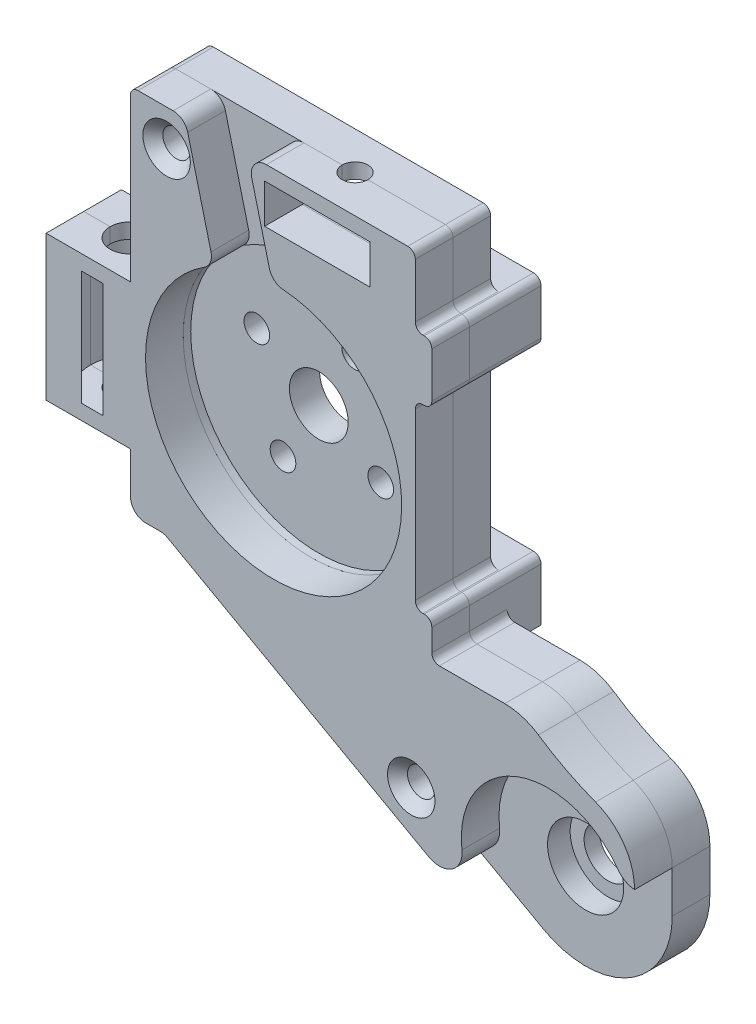
from build123d import *

# Parameters (mm, degrees)
SKETCH1_W                                      = 5.2
SKETCH1_H                                      = 14
SKETCH1_R                                      = 3.2
SKETCH1_R_2                                    = 1.7
SKETCH1_R_3                                    = 3.9
BOSS_EXTRUDE1_DEPTH                            = 10
SKETCH2_R                                      = 2.6
CUT_EXTRUDE1_DEPTH                             = 20
SKETCH3_R                                      = 5.1
CUT_EXTRUDE2_DEPTH                             = 15.2
BOSS_EXTRUDE2_DEPTH                            = 0.45
BOSS_EXTRUDE2_DEPTH_BACK                       = 0.45
SKETCH4_R                                      = 5.1
SKETCH4_R_2                                    = 4.7
BOSS_EXTRUDE3_DEPTH                            = 0.45
BOSS_EXTRUDE3_DEPTH_BACK                       = 0.45
SKETCH5_R                                      = 5.1
SKETCH5_R_2                                    = 4.7
CUT_EXTRUDE3_START                             = -11
CUT_EXTRUDE3_OUTLINE_W                         = 2.009975124
CUT_EXTRUDE3_OUTLINE_H                         = 0.9
CUT_EXTRUDE3_OUTLINE_W_2                       = 3
CUT_EXTRUDE3_OUTLINE_H_2                       = 19.2
CUT_EXTRUDE3_DEPTH                             = 12
CUT_EXTRUDE4_START                             = -1
SKETCH7_R                                      = 11.5
CUT_EXTRUDE4_DEPTH                             = 1
SKETCH8_R                                      = 9.6
CUT_EXTRUDE5_DEPTH                             = 1
SKETCH11_R                                     = 17
CUT_EXTRUDE6_DEPTH                             = 6
SKETCH12_W                                     = 8
SKETCH12_H                                     = 8
BOSS_EXTRUDE4_DEPTH                            = 4.5
SKETCH13_R                                     = 1.625
CUT_EXTRUDE7_DEPTH                             = 9.5
SKETCH21_W                                     = 2.189492289
SKETCH21_H                                     = 4.939086821
BOSS_EXTRUDE5_DEPTH                            = 10
SKETCH24_W                                     = 14
SKETCH24_H                                     = 5.2
SKETCH24_W_2                                   = 37.810507711
SKETCH24_H_2                                   = 3.7
BOSS_EXTRUDE7_DEPTH                            = 10
SKETCH25_W                                     = 14
SKETCH25_H                                     = 5.2
CUT_EXTRUDE12_DEPTH                            = 125.196397338
FILLET1_R                                      = 1
FILLET4_R                                      = 8
CUT_EXTRUDE9_START                             = -5
SKETCH19_R                                     = 11.5
CUT_EXTRUDE9_DEPTH                             = 5
FILLET3_START                                  = 5
FILLET3_DEPTH                                  = 5
SKETCH20_R                                     = 1.7
CUT_EXTRUDE10_DEPTH                            = 2
BOSS_EXTRUDE8_DEPTH                            = 10
FILLET5_R                                      = 2
SKETCH28_R                                     = 5.2
CUT_EXTRUDE13_DEPTH                            = 15.2
CUT_EXTRUDE14_DEPTH                            = 5
SKETCH30_R                                     = 1.6
CUT_EXTRUDE15_DEPTH                            = 10
SKETCH31_R                                     = 1.825
CUT_EXTRUDE16_DEPTH                            = 10
FILLET9_R                                      = 2
BOSS_EXTRUDE9_DEPTH                            = 2.5
CSK_FOR_M3_FLAT_HEAD_MACHINE_SCREW1_AT_2_COUNT = 2
CSK_FOR_M3_FLAT_HEAD_MACHINE_SCREW1_AT_2_PITCH = 65.777598675
SKETCH37_R                                     = 5.05
CUT_EXTRUDE17_DEPTH                            = 3
SKETCH38_R                                     = 2.2
CUT_EXTRUDE18_DEPTH                            = 10
CSK_FOR_M3_FLAT_HEAD_MACHINE_SCREW2_AT_2_COUNT = 2
CSK_FOR_M3_FLAT_HEAD_MACHINE_SCREW2_AT_2_PITCH = 13.435028843
CSK_FOR_M3_FLAT_HEAD_MACHINE_SCREW2_AT_3_COUNT = 2
CSK_FOR_M3_FLAT_HEAD_MACHINE_SCREW2_AT_3_PITCH = 13.435028843
CSK_FOR_M3_FLAT_HEAD_MACHINE_SCREW2_AT_4_COUNT = 2
CSK_FOR_M3_FLAT_HEAD_MACHINE_SCREW2_AT_4_PITCH = 19


with BuildPart() as part:
    # Sketch1 → Boss-Extrude1 (new body)
    with BuildSketch(Plane(origin=(0, 0, 0), x_dir=(0, 1, 0), z_dir=(0, 0, 1))):
        with BuildLine():
            Line((44.859200041, 91.5), (44.859200041, 77.3))
            Line((44.859200041, 77.3), (39.859200041, 77.3))
            Line((39.859200041, 77.3), (12.058048672, 27.485891377))
            ThreePointArc((12.058048672, 27.485891377), (12.182830244, 16.059150365), (22.1, 10.381499035))
            Line((22.1, 10.381499035), (33.6, 10.381499035))
            ThreePointArc((33.6, 10.381499035), (36.198905176, 18.091500699), (40.42011322, 25.047062246))
            Line((40.42011322, 25.047062246), (40.42011322, 39.489492289))
            Line((40.42011322, 39.489492289), (82.859200041, 39.489492289))
            Line((82.859200041, 39.489492289), (82.859200041, 77.3))
            Line((82.859200041, 77.3), (64.059200041, 77.3))
            Line((64.059200041, 77.3), (64.059200041, 91.5))
            Line((64.059200041, 91.5), (44.859200041, 91.5))
        make_face()
        with Locations((78.259200041, 52.489492289)):
            Rectangle(SKETCH1_W, SKETCH1_H, mode=Mode.SUBTRACT)
        with Locations(Location((22.1, 21.881499035, 0), (0, 0, 270))):
            Circle(SKETCH1_R, mode=Mode.SUBTRACT)
        with Locations(Location((61.109200041, 66.527241336, 0), (0, 0, 270))):
            Circle(SKETCH1_R_2, mode=Mode.SUBTRACT)
        with Locations(Location((51.609200041, 50.072758664, 0), (0, 0, 270))):
            Circle(SKETCH1_R_2, mode=Mode.SUBTRACT)
        with Locations(Location((64.586441377, 53.55, 0), (0, 0, 270))):
            Circle(SKETCH1_R_2, mode=Mode.SUBTRACT)
        with Locations(Location((56.359200041, 58.3, 0), (0, 0, 270))):
            Circle(SKETCH1_R_3, mode=Mode.SUBTRACT)
        with Locations(Location((48.131958705, 63.05, 0), (0, 0, 270))):
            Circle(SKETCH1_R_2, mode=Mode.SUBTRACT)
    extrude(amount=BOSS_EXTRUDE1_DEPTH)

    # Sketch2 → Cut-Extrude1 (cut)
    with BuildSketch(Plane.XZ.offset(-44.859200041)):
        with Locations(Location((-82.4, 5, 0), (0, 0, 270))):
            Circle(SKETCH2_R)
    extrude(amount=-CUT_EXTRUDE1_DEPTH, mode=Mode.SUBTRACT)

    # Sketch3 → Cut-Extrude2 (cut)
    with BuildSketch(Plane(origin=(0, 46.859200041, 0), x_dir=(-1, 0, 0), z_dir=(0, -1, 0))):
        with Locations((82.4, -5)):
            Circle(SKETCH3_R)
    extrude(amount=-CUT_EXTRUDE2_DEPTH, mode=Mode.SUBTRACT)

    # Sketch4 → Boss-Extrude2 (add, two sides: drawn at the far end of the back side and taken through both)
    with BuildSketch(Plane(origin=(0, 51.909200041, 0), x_dir=(-1, 0, 0), z_dir=(0, -1, 0)).offset(-BOSS_EXTRUDE2_DEPTH_BACK)):
        with Locations((82.4, -5)):
            Circle(SKETCH4_R)
        with Locations(Location((82.4, -5, 0), (0, 0, 90))):
            Circle(SKETCH4_R_2, mode=Mode.SUBTRACT)
    extrude(amount=BOSS_EXTRUDE2_DEPTH + BOSS_EXTRUDE2_DEPTH_BACK)

    # Sketch5 → Boss-Extrude3 (add, two sides: drawn at the far end of the back side and taken through both)
    with BuildSketch(Plane(origin=(0, 59.009200041, 0), x_dir=(1, 0, 0), z_dir=(0, 1, 0)).offset(-BOSS_EXTRUDE3_DEPTH_BACK)):
        with Locations((-82.4, -5)):
            Circle(SKETCH5_R)
        with Locations(Location((-82.4, -5, 0), (0, 0, 90))):
            Circle(SKETCH5_R_2, mode=Mode.SUBTRACT)
    extrude(amount=BOSS_EXTRUDE3_DEPTH + BOSS_EXTRUDE3_DEPTH_BACK)

    # Cut-Extrude3: read off the stored shape, not the designer's step
    # Cut-Extrude3 outline → Cut-Extrude3 (cut)
    with BuildSketch(Plane.XY.offset(10).offset(CUT_EXTRUDE3_START)):
        with Locations((-82.4, 59.009200041)):
            Rectangle(CUT_EXTRUDE3_OUTLINE_W, CUT_EXTRUDE3_OUTLINE_H)
        with Locations((-82.4, 51.909200041)):
            Rectangle(CUT_EXTRUDE3_OUTLINE_W, CUT_EXTRUDE3_OUTLINE_H)
        with Locations((-90, 54.459200041)):
            Rectangle(CUT_EXTRUDE3_OUTLINE_W_2, CUT_EXTRUDE3_OUTLINE_H_2)
    extrude(amount=CUT_EXTRUDE3_DEPTH, mode=Mode.SUBTRACT)

    # Sketch7 → Cut-Extrude4 (cut)
    with BuildSketch(Plane.XY.offset(10).offset(CUT_EXTRUDE4_START)):
        with Locations((-21.881499035, 22.1)):
            Circle(SKETCH7_R)
    extrude(amount=CUT_EXTRUDE4_DEPTH, mode=Mode.SUBTRACT)

    # Sketch8 → Cut-Extrude5 (cut)
    with BuildSketch(Plane.XY.offset(9)):
        with Locations((-21.881499035, 22.1)):
            Circle(SKETCH8_R)
    extrude(amount=-CUT_EXTRUDE5_DEPTH, mode=Mode.SUBTRACT)

    # Sketch11 → Cut-Extrude6 (cut)
    with BuildSketch(Plane.XY.offset(10)):
        with Locations((-58.3, 56.359200041)):
            Circle(SKETCH11_R)
    extrude(amount=-CUT_EXTRUDE6_DEPTH, mode=Mode.SUBTRACT)

    # Sketch12 → Boss-Extrude4 (add)
    with BuildSketch(Plane(origin=(0, 0, 0), x_dir=(1, 0, 0), z_dir=(0, 0, -1))):
        with Locations((-73.3, -41.359200041)):
            Rectangle(SKETCH12_W, SKETCH12_H)
        with Locations((-41.3, -41.359200041)):
            Rectangle(SKETCH12_W, SKETCH12_H)
        with Locations((-73.3, -73.359200041)):
            Rectangle(SKETCH12_W, SKETCH12_H)
        with Locations((-41.3, -73.359200041)):
            Rectangle(SKETCH12_W, SKETCH12_H)
    extrude(amount=BOSS_EXTRUDE4_DEPTH)

    # Sketch13 → Cut-Extrude7 (cut)
    with BuildSketch(Plane(origin=(0, 0, -4.5), x_dir=(1, 0, 0), z_dir=(0, 0, -1))):
        with Locations(Location((-73.3, -41.359200041, 0), (0, 0, 180))):
            Circle(SKETCH13_R)
        with Locations(Location((-73.3, -73.359200041, 0), (0, 0, 180))):
            Circle(SKETCH13_R)
        with Locations(Location((-41.3, -73.421357557, 0), (0, 0, 180))):
            Circle(SKETCH13_R)
        with Locations(Location((-41.3, -41.421357557, 0), (0, 0, 180))):
            Circle(SKETCH13_R)
    extrude(amount=-CUT_EXTRUDE7_DEPTH, mode=Mode.SUBTRACT)

    # Sketch21 → Boss-Extrude5 (add)
    with BuildSketch(Plane.XY):
        Polygon((-39.489492289, 77.359200041), (-37.3, 77.359200041), (-37.3, 69.359200041), (-39.489492289, 69.359200041), (-39.489492289, 72.308843814), align=None)
        with Locations((-38.394746145, 42.88965663)):
            Rectangle(SKETCH21_W, SKETCH21_H)
    extrude(amount=BOSS_EXTRUDE5_DEPTH)

    # Sketch24 → Boss-Extrude7 (add, through all)
    with BuildSketch(Plane(origin=(0, 0, 0), x_dir=(1, 0, 0), z_dir=(0, 0, -1))):
        with Locations((-52.489492289, -78.259200041)):
            Rectangle(SKETCH24_W, SKETCH24_H)
        with Locations((-58.394746145, -84.709200041)):
            Rectangle(SKETCH24_W_2, SKETCH24_H_2)
    extrude(amount=-BOSS_EXTRUDE7_DEPTH)

    # Sketch25 → Cut-Extrude12 (cut, through all)
    with BuildSketch(Plane(origin=(0, 0, 0), x_dir=(1, 0, 0), z_dir=(0, 0, -1))):
        with Locations((-52.489492289, -81.959200041)):
            Rectangle(SKETCH25_W, SKETCH25_H)
    extrude(amount=-CUT_EXTRUDE12_DEPTH, mode=Mode.SUBTRACT)

    # Fillet1
    fillet1_edges = [part.edges().sort_by_distance(p)[0] for p in [
        (-37.3, 45.359200041, 2.75),
        (-37.3, 77.359200041, 2.75),
        (-37.3, 69.359200041, 2.75),
        (-39.489492289, 77.359200041, 5),
        (-39.489492289, 69.359200041, 5),
        (-39.489492289, 45.359200041, 5),
        (-37.3, 40.42011322, 5),
        (-39.489492289, 86.559200041, 5),
        (-77.3, 86.559200041, 5),
    ]]
    fillet(fillet1_edges, radius=FILLET1_R)

    # Fillet4
    fillet4_edges = [part.edges().sort_by_distance(p)[0] for p in [
        (-25.047062246, 40.42011322, 5),
        (-10.381499035, 33.6, 5),
    ]]
    fillet(fillet4_edges, radius=FILLET4_R)

    # Sketch19 → Cut-Extrude9 (cut)
    with BuildSketch(Plane.XY.offset(10).offset(CUT_EXTRUDE9_START)):
        with Locations((-21.881499035, 22.1)):
            Circle(SKETCH19_R)
    extrude(amount=CUT_EXTRUDE9_DEPTH, mode=Mode.SUBTRACT)

    # Fillet3: read off the stored shape, not the designer's step
    # Fillet3 outline → Fillet3 (cut)
    with BuildSketch(Plane.XY.offset(FILLET3_START)):
        with BuildLine():
            Line((-10.381499035, 22.1), (-10.381499035, 27.648124873))
            ThreePointArc((-10.381499035, 27.648124873), (-11.61972956, 28.017411627), (-12.587785338, 28.873247798))
            ThreePointArc((-12.587785338, 28.873247798), (-10.946973268, 25.661761677), (-10.381499035, 22.1))
        make_face()
        with BuildLine():
            ThreePointArc((-27.485891377, 12.058048672), (-31.440236805, 15.706211433), (-33.302433702, 20.753801155))
            ThreePointArc((-33.302433702, 20.753801155), (-34.613863119, 17.909035082), (-37.743823356, 17.782979371))
            Line((-37.743823356, 17.782979371), (-27.485891377, 12.058048672))
        make_face()
    extrude(amount=FILLET3_DEPTH, mode=Mode.SUBTRACT)

    # Sketch20 → Cut-Extrude10 (cut)
    with BuildSketch(Plane(origin=(0, 84.559200041, 0), x_dir=(-1, 0, 0), z_dir=(0, 1, 0))):
        with Locations(Location((52.489492289, 5, 0), (0, 0, 270))):
            Circle(SKETCH20_R)
    extrude(amount=CUT_EXTRUDE10_DEPTH, mode=Mode.SUBTRACT)

    # Sketch26 → Boss-Extrude8 (add)
    with BuildSketch(Plane.XY):
        Polygon((-77.3, 39.859200041), (-77.3, 37.359200041), (-72.820499496, 37.359200041), align=None)
    extrude(amount=BOSS_EXTRUDE8_DEPTH)

    # Fillet5
    fillet5_edges = [part.edges().sort_by_distance(p)[0] for p in [
        (-77.3, 37.359200041, 2.75),
        (-72.820499496, 37.359200041, 5),
    ]]
    fillet(fillet5_edges, radius=FILLET5_R)

    # Sketch28 → Cut-Extrude13 (cut)
    with BuildSketch(Plane(origin=(0, 46.859200041, 0), x_dir=(-1, 0, 0), z_dir=(0, -1, 0))):
        with Locations((82.4, -5)):
            Circle(SKETCH28_R)
    extrude(amount=-CUT_EXTRUDE13_DEPTH, mode=Mode.SUBTRACT)

    # Sketch29 → Cut-Extrude14 (cut)
    with BuildSketch(Plane.XY.offset(10)):
        with BuildLine():
            Line((-70.084119458, 86.559200041), (-66.238298125, 71.391945062))
            ThreePointArc((-66.238298125, 71.391945062), (-64.401278814, 72.226600484), (-62.478307692, 72.837723786))
            Line((-62.478307692, 72.837723786), (-65.957536212, 86.559200041))
            Line((-65.957536212, 86.559200041), (-70.084119458, 86.559200041))
        make_face()
        with BuildLine():
            Line((-65.957536212, 86.559200041), (-62.478307692, 72.837723786))
            ThreePointArc((-62.478307692, 72.837723786), (-60.49647463, 73.216705764), (-58.483698716, 73.358207505))
            Line((-58.483698716, 73.358207505), (-59.974154752, 79.236308638))
            Line((-59.974154752, 79.236308638), (-61.830952967, 86.559200041))
            Line((-61.830952967, 86.559200041), (-65.957536212, 86.559200041))
        make_face()
    extrude(amount=-CUT_EXTRUDE14_DEPTH, mode=Mode.SUBTRACT)


with BuildPart() as body_2:
    # Split1: the piece on the far side of the plane
    add(part.part)
    split(bisect_by=Plane.XY.offset(5), keep=Keep.BOTTOM)

    # Sketch30 → Cut-Extrude15 (cut)
    with BuildSketch(Plane(origin=(0, 0, 0), x_dir=(1, 0, 0), z_dir=(0, 0, -1))):
        with Locations(Location((-72.5, -81.759200041, 0), (0, 0, 180))):
            Circle(SKETCH30_R)
        with Locations(Location((-40.028711247, -24.555110203, 0), (0, 0, 180))):
            Circle(SKETCH30_R)
        with BuildLine():
            Line((-58.439210263, -32.196021535), (-46.214226038, -25.373283031))
            ThreePointArc((-46.214226038, -25.373283031), (-44.853674414, -25.759157726), (-45.239549109, -27.119709349))
            Line((-45.239549109, -27.119709349), (-57.464533334, -33.942447853))
            ThreePointArc((-57.464533334, -33.942447853), (-58.825084958, -33.556573159), (-58.439210263, -32.196021535))
        make_face()
    extrude(amount=-CUT_EXTRUDE15_DEPTH, mode=Mode.SUBTRACT)


with BuildPart() as part_1:
    add(part.part)

    # Split1
    split(bisect_by=Plane.XY.offset(5), keep=Keep.TOP)

    # Sketch31 → Cut-Extrude16 (cut)
    with BuildSketch(Plane(origin=(0, 0, 5), x_dir=(1, 0, 0), z_dir=(0, 0, -1))):
        with Locations(Location((-72.5, -81.759200041, 0), (0, 0, 180))):
            Circle(SKETCH31_R)
        with Locations(Location((-40.028711247, -24.555110203, 0), (0, 0, 180))):
            Circle(SKETCH31_R)
    extrude(amount=-CUT_EXTRUDE16_DEPTH, mode=Mode.SUBTRACT)

    # Fillet9
    fillet9_edges = [part_1.edges().sort_by_distance(p)[0] for p in [
        (-70.084119458, 86.559200041, 7.5),
        (-61.830952967, 86.559200041, 7.5),
        (-58.483698716, 73.358207505, 7.5),
        (-66.238298125, 71.391945062, 7.5),
    ]]
    fillet(fillet9_edges, radius=FILLET9_R)

    # Sketch33 → Boss-Extrude9 (add)
    with BuildSketch(Plane(origin=(0, 0, 5), x_dir=(1, 0, 0), z_dir=(0, 0, -1))):
        with BuildLine():
            Line((-58.34174257, -32.370664167), (-46.116758345, -25.547925663))
            ThreePointArc((-46.116758345, -25.547925663), (-45.028317046, -25.856625419), (-45.337016802, -26.945066718))
            Line((-45.337016802, -26.945066718), (-57.562001027, -33.767805221))
            ThreePointArc((-57.562001027, -33.767805221), (-58.650442326, -33.459105466), (-58.34174257, -32.370664167))
        make_face()
    extrude(amount=BOSS_EXTRUDE9_DEPTH)


with BuildPart() as csk_for_m3_flat_head_machine_screw1_tool:
    # Sketch34 → CSK for M3 Flat Head Machine Screw1 (revolve)
    with BuildSketch(Plane(origin=(-40.028711247, 24.555110203, 10), x_dir=(0, -1, 0), z_dir=(1, 0, 0))):
        Polygon((0, 0), (0, 14.5), (1.7, 14.5), (1.7, 1.45), (3.15, 0), align=None)
    csk_for_m3_flat_head_machine_screw1 = revolve(axis=Axis((-40.028711247, 24.555110203, 16.35), (0, 0, -1)))


with BuildPart() as part_2:
    add(part_1.part)

    # CSK for M3 Flat Head Machine Screw1: cut by csk_for_m3_flat_head_machine_screw1_tool
    add(csk_for_m3_flat_head_machine_screw1_tool.part, mode=Mode.SUBTRACT)


with BuildPart() as body_2_1:
    add(body_2.part)

    # CSK for M3 Flat Head Machine Screw1: cut by csk_for_m3_flat_head_machine_screw1_tool
    add(csk_for_m3_flat_head_machine_screw1_tool.part, mode=Mode.SUBTRACT)


with BuildPart() as csk_for_m3_flat_head_machine_screw1_at_2_tool:
    # CSK for M3 Flat Head Machine Screw1 at 2: CSK for M3 Flat Head Machine Screw1 ×2
    with Locations(*[Vector(-0.4936526934195103, 0.8696591391342144, 0) * (i * CSK_FOR_M3_FLAT_HEAD_MACHINE_SCREW1_AT_2_PITCH) for i in range(1, CSK_FOR_M3_FLAT_HEAD_MACHINE_SCREW1_AT_2_COUNT)]):
        add(csk_for_m3_flat_head_machine_screw1)


with BuildPart() as part_3:
    add(part_2.part)

    # CSK for M3 Flat Head Machine Screw1 at 2: cut by csk_for_m3_flat_head_machine_screw1_at_2_tool
    add(csk_for_m3_flat_head_machine_screw1_at_2_tool.part, mode=Mode.SUBTRACT)


with BuildPart() as body_2_2:
    add(body_2_1.part)

    # CSK for M3 Flat Head Machine Screw1 at 2: cut by csk_for_m3_flat_head_machine_screw1_at_2_tool
    add(csk_for_m3_flat_head_machine_screw1_at_2_tool.part, mode=Mode.SUBTRACT)

    # Sketch37 → Cut-Extrude17 (cut)
    with BuildSketch(Plane.XY.offset(5)):
        with Locations((-21.881499035, 22.1)):
            Circle(SKETCH37_R)
    extrude(amount=-CUT_EXTRUDE17_DEPTH, mode=Mode.SUBTRACT)

    # Sketch38 → Cut-Extrude18 (cut)
    with BuildSketch(Plane.XY.offset(5)):
        with Locations((-72.5, 81.759200041)):
            Circle(SKETCH38_R)
        with Locations((-40.028711247, 24.555110203)):
            Circle(SKETCH38_R)
    extrude(amount=-CUT_EXTRUDE18_DEPTH, mode=Mode.SUBTRACT)

    # Sketch39 → CSK for M3 Flat Head Machine Screw2 (revolve, cut)
    with BuildSketch(Plane(origin=(-53.55, 64.586441377, 0), x_dir=(0, 1, 0), z_dir=(1, 0, 0))):
        Polygon((0, 0), (0, 10), (1.7, 10), (1.7, 1.45), (3.15, 0), align=None)
    csk_for_m3_flat_head_machine_screw2 = revolve(axis=Axis((-53.55, 64.586441377, -6.35), (0, 0, 1)), mode=Mode.SUBTRACT)

    # CSK for M3 Flat Head Machine Screw2 at 2: CSK for M3 Flat Head Machine Screw2 ×2
    with Locations(*[Vector(0.2588190451025168, -0.9659258262890694, 0) * (i * CSK_FOR_M3_FLAT_HEAD_MACHINE_SCREW2_AT_2_PITCH) for i in range(1, CSK_FOR_M3_FLAT_HEAD_MACHINE_SCREW2_AT_2_COUNT)]):
        add(csk_for_m3_flat_head_machine_screw2, mode=Mode.SUBTRACT)

    # CSK for M3 Flat Head Machine Screw2 at 3: CSK for M3 Flat Head Machine Screw2 ×2
    with Locations(*[Vector(-0.9659258262890705, -0.2588190451025125, 0) * (i * CSK_FOR_M3_FLAT_HEAD_MACHINE_SCREW2_AT_3_PITCH) for i in range(1, CSK_FOR_M3_FLAT_HEAD_MACHINE_SCREW2_AT_3_COUNT)]):
        add(csk_for_m3_flat_head_machine_screw2, mode=Mode.SUBTRACT)

    # CSK for M3 Flat Head Machine Screw2 at 4: CSK for M3 Flat Head Machine Screw2 ×2
    with Locations(*[Vector(-0.5000000000000041, -0.8660254037844364, 0) * (i * CSK_FOR_M3_FLAT_HEAD_MACHINE_SCREW2_AT_4_PITCH) for i in range(1, CSK_FOR_M3_FLAT_HEAD_MACHINE_SCREW2_AT_4_COUNT)]):
        add(csk_for_m3_flat_head_machine_screw2, mode=Mode.SUBTRACT)


solid = Compound([part_3.part, body_2_2.part])
